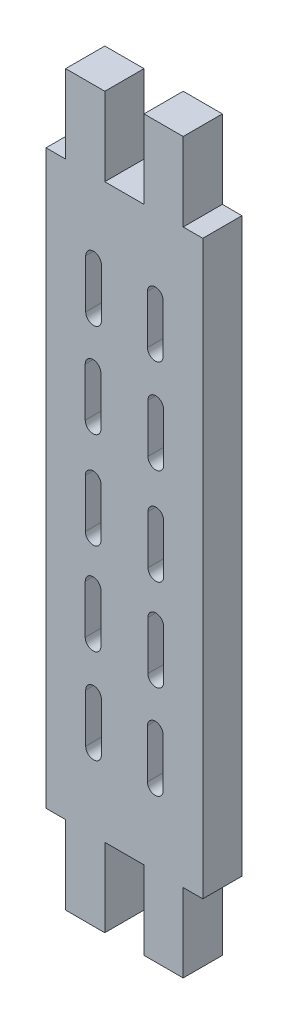
from build123d import *

# Parameters (mm, degrees)
BOSS_EXTRUDE1_DEPTH = 5


with BuildPart() as part:
    # Sketch1 → Boss-Extrude1 (new body)
    with BuildSketch(Plane.XY):
        Polygon((-7.5, 46.5), (-7.5, 36.5), (-10, 36.5), (-10, -36.5), (-7.5, -36.5), (-7.5, -41.5), (-7.5, -46.5), (-2.5, -46.5), (-2.5, -36.5), (2.5, -36.5), (2.5, -46.5), (7.5, -46.5), (7.5, -36.5), (10, -36.5), (10, 36.5), (7.5, 36.5), (7.5, 46.5), (2.5, 46.5), (2.5, 36.5), (-2.5, 36.5), (-2.5, 46.5), align=None)
        with BuildLine():
            Line((-2.939100239, -20.9), (-2.939100239, -27.1))
            ThreePointArc((-2.939100239, -27.1), (-3.939100239, -28.1), (-4.939100239, -27.1))
            Line((-4.939100239, -27.1), (-4.939100239, -20.9))
            ThreePointArc((-4.939100239, -20.9), (-3.939100239, -19.9), (-2.939100239, -20.9))
        make_face(mode=Mode.SUBTRACT)
        with BuildLine():
            Line((-3, -8.9), (-3, -15.1))
            ThreePointArc((-3, -15.1), (-4, -16.1), (-5, -15.1))
            Line((-5, -15.1), (-5, -8.9))
            ThreePointArc((-5, -8.9), (-4, -7.9), (-3, -8.9))
        make_face(mode=Mode.SUBTRACT)
        with BuildLine():
            ThreePointArc((-4.988251441, 2.802900728), (-3.988251441, 3.802900728), (-2.988251441, 2.802900728))
            Line((-2.988251441, 2.802900728), (-2.988251441, -3.397099272))
            ThreePointArc((-2.988251441, -3.397099272), (-3.988251441, -4.397099272), (-4.988251441, -3.397099272))
            Line((-4.988251441, -3.397099272), (-4.988251441, 2.802900728))
        make_face(mode=Mode.SUBTRACT)
        with BuildLine():
            ThreePointArc((4.939100239, -27.1), (3.939100239, -28.1), (2.939100239, -27.1))
            Line((2.939100239, -27.1), (2.939100239, -20.9))
            ThreePointArc((2.939100239, -20.9), (3.939100239, -19.9), (4.939100239, -20.9))
            Line((4.939100239, -20.9), (4.939100239, -27.1))
        make_face(mode=Mode.SUBTRACT)
        with BuildLine():
            ThreePointArc((5, -15.1), (4, -16.1), (3, -15.1))
            Line((3, -15.1), (3, -8.9))
            ThreePointArc((3, -8.9), (4, -7.9), (5, -8.9))
            Line((5, -8.9), (5, -15.1))
        make_face(mode=Mode.SUBTRACT)
        with BuildLine():
            Line((3.011748559, -3.397099272), (3.011748559, 2.802900728))
            ThreePointArc((3.011748559, 2.802900728), (4.011748559, 3.802900728), (5.011748559, 2.802900728))
            Line((5.011748559, 2.802900728), (5.011748559, -3.397099272))
            ThreePointArc((5.011748559, -3.397099272), (4.011748559, -4.397099272), (3.011748559, -3.397099272))
        make_face(mode=Mode.SUBTRACT)
        with BuildLine():
            ThreePointArc((-5, 15.1), (-4, 16.1), (-3, 15.1))
            Line((-3, 15.1), (-3, 8.9))
            ThreePointArc((-3, 8.9), (-4, 7.9), (-5, 8.9))
            Line((-5, 8.9), (-5, 15.1))
        make_face(mode=Mode.SUBTRACT)
        with BuildLine():
            ThreePointArc((-4.939100239, 27.1), (-3.939100239, 28.1), (-2.939100239, 27.1))
            Line((-2.939100239, 27.1), (-2.939100239, 20.9))
            ThreePointArc((-2.939100239, 20.9), (-3.939100239, 19.9), (-4.939100239, 20.9))
            Line((-4.939100239, 20.9), (-4.939100239, 27.1))
        make_face(mode=Mode.SUBTRACT)
        with BuildLine():
            Line((3, 8.9), (3, 15.1))
            ThreePointArc((3, 15.1), (4, 16.1), (5, 15.1))
            Line((5, 15.1), (5, 8.9))
            ThreePointArc((5, 8.9), (4, 7.9), (3, 8.9))
        make_face(mode=Mode.SUBTRACT)
        with BuildLine():
            Line((2.939100239, 20.9), (2.939100239, 27.1))
            ThreePointArc((2.939100239, 27.1), (3.939100239, 28.1), (4.939100239, 27.1))
            Line((4.939100239, 27.1), (4.939100239, 20.9))
            ThreePointArc((4.939100239, 20.9), (3.939100239, 19.9), (2.939100239, 20.9))
        make_face(mode=Mode.SUBTRACT)
    extrude(amount=BOSS_EXTRUDE1_DEPTH)


solid = part.part
